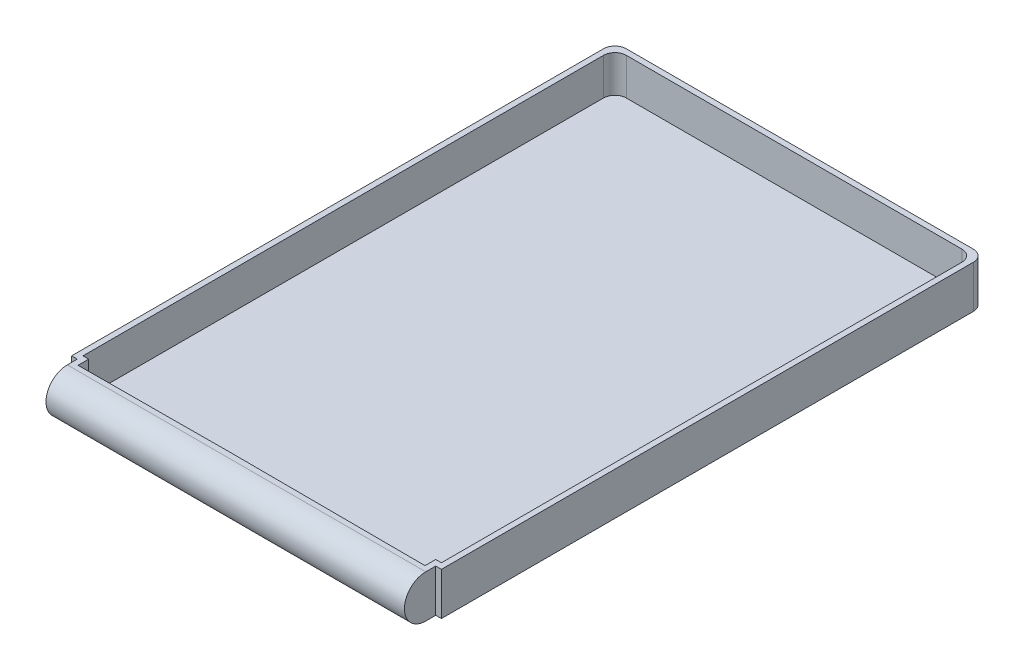
from build123d import *

# Parameters (mm, degrees)
SALIENTE_EXTRUIR2_DEPTH = 15
CORTAR_EXTRUIR5_START   = -126
CORTAR_EXTRUIR5_DEPTH   = 126
CORTAR_EXTRUIR6_DEPTH   = 13


# Read off the part's stored shape, not the designer's step: Cortar-Extruir5
with BuildPart() as part:
    # Croquis1 → Saliente-Extruir2 (new body)
    with BuildSketch(Plane(origin=(0, 0, 0), x_dir=(1, 0, 0), z_dir=(0, 1, 0))):
        with BuildLine():
            Line((0, 0), (2, 0))
            Line((2, 0), (2, -11))
            Line((2, -11), (128, -11))
            Line((128, -11), (128, 0))
            Line((128, 0), (130, 0))
            Line((130, 0), (130, 187))
            ThreePointArc((130, 187), (128.828427125, 189.828427125), (126, 191))
            Line((126, 191), (4, 191))
            ThreePointArc((4, 191), (1.171572875, 189.828427125), (0, 187))
            Line((0, 187), (0, 0))
        make_face()
    extrude(amount=SALIENTE_EXTRUIR2_DEPTH)

    # Cortar-Extruir5 outline → Cortar-Extruir5 (cut)
    with BuildSketch(Plane(origin=(128, 0, 0), x_dir=(0, 0, -1), z_dir=(1, 0, 0)).offset(CORTAR_EXTRUIR5_START)):
        with BuildLine():
            Line((-11, 0), (-3.5, 0))
            ThreePointArc((-3.5, 0), (-8.803300859, 2.196699141), (-11, 7.5))
            Line((-11, 7.5), (-11, 0))
        make_face()
        with BuildLine():
            Line((-11, 15), (-11, 7.5))
            ThreePointArc((-11, 7.5), (-8.803300859, 12.803300859), (-3.5, 15))
            Line((-3.5, 15), (-11, 15))
        make_face()
    extrude(amount=CORTAR_EXTRUIR5_DEPTH, mode=Mode.SUBTRACT)

    # Croquis3 → Cortar-Extruir6 (cut)
    with BuildSketch(Plane(origin=(0, 15, 0), x_dir=(1, 0, 0), z_dir=(0, 1, 0))):
        with BuildLine():
            Line((2, 80.037921952), (2, 185))
            ThreePointArc((2, 185), (3.171572875, 187.828427125), (6, 189))
            Line((6, 189), (124, 189))
            ThreePointArc((124, 189), (126.828427125, 187.828427125), (128, 185))
            Line((128, 185), (128, 95.850744251))
            Line((128, 95.850744251), (128, 2))
            Line((128, 2), (126, 2))
            Line((126, 2), (126, -1.75))
            Line((126, -1.75), (57.409845297, -1.5))
            Line((57.409845297, -1.5), (4, -1.75))
            Line((4, -1.75), (4, 2))
            Line((4, 2), (2, 2))
            Line((2, 2), (2, 80.037921952))
        make_face()
    extrude(amount=-CORTAR_EXTRUIR6_DEPTH, mode=Mode.SUBTRACT)


solid = part.part
